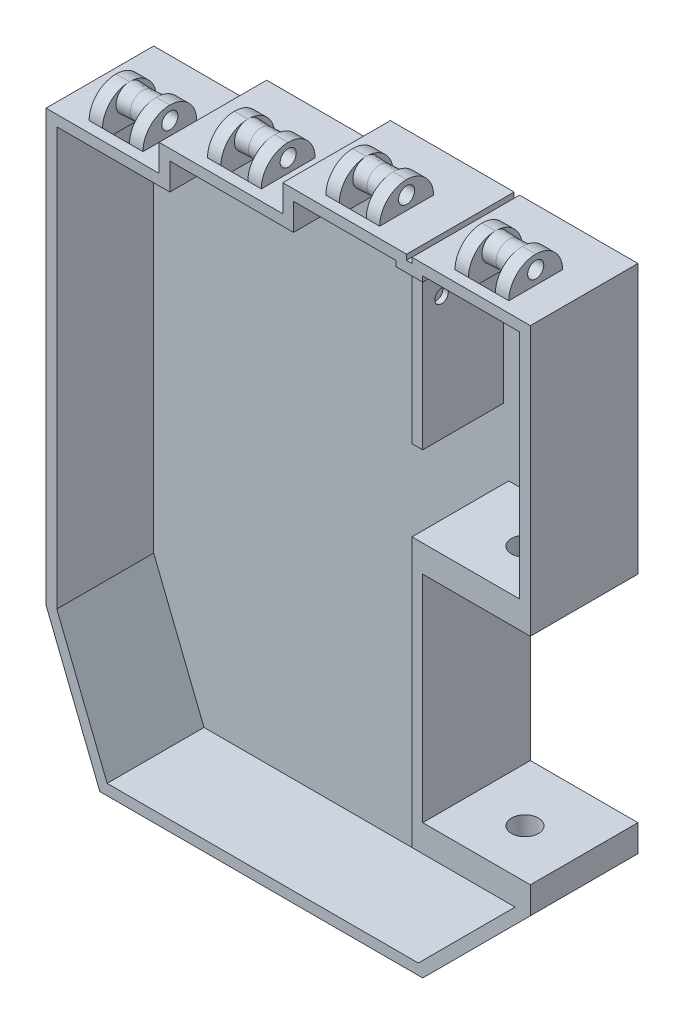
from build123d import *

# Parameters (mm, degrees)
BOSS_EXTRUDE1_DEPTH       = 20
SKETCH2_W                 = 20
SKETCH2_H                 = 40
CUT_EXTRUDE1_DEPTH        = 142.509716981
SHELL1_T                  = -2
SHELL1_THICKNESS_2_FACE_W = 20
SHELL1_THICKNESS_2_FACE_H = 18
SHELL1_THICKNESS_2_DEPTH  = 3
SHELL1_THICKNESS_3_FACE_W = 18
SHELL1_THICKNESS_3_FACE_H = 20
SHELL1_THICKNESS_3_DEPTH  = 3
CUT_EXTRUDE14_REACH       = 110.167
SKETCH34_R                = 2.5
SKETCH3_W                 = 2.5
SKETCH3_H                 = 10
BOSS_EXTRUDE2_DEPTH       = 5
FILLET2_R                 = 5
CUT_EXTRUDE3_REACH        = 149.838
SKETCH6_R                 = 1.5
SKETCH21_R                = 2.5
SKETCH21_R_2              = 1.5
BOSS_EXTRUDE10_DEPTH      = 2.5
BOSS_EXTRUDE10_DRAFT      = 3
MIRROR7_COPY_1_SKETCH_R   = 2.5
MIRROR7_COPY_1_SKETCH_R_2 = 1.5
MIRROR7_COPY_1_DEPTH      = 2.5
MIRROR7_COPY_1_DRAFT      = 3
SKETCH26_W                = 5
SKETCH26_H                = 10
CUT_EXTRUDE8_DEPTH        = 2
SKETCH7_W                 = 2.5
SKETCH7_H                 = 10
BOSS_EXTRUDE4_DEPTH       = 5
FILLET4_R                 = 5
SKETCH22_R                = 2.5
BOSS_EXTRUDE11_DEPTH      = 2.5
BOSS_EXTRUDE11_TAPER      = 3
SKETCH23_R                = 1.5
CUT_EXTRUDE7_DEPTH        = 10
SKETCH27_W                = 5
SKETCH27_H                = 10
CUT_EXTRUDE9_DEPTH        = 2
SKETCH10_W                = 2.5
SKETCH10_H                = 10
BOSS_EXTRUDE6_DEPTH       = 5
FILLET6_R                 = 5
SKETCH28_R                = 2.5
BOSS_EXTRUDE12_DEPTH      = 2.5
BOSS_EXTRUDE12_TAPER      = 3
SKETCH29_R                = 1.5
CUT_EXTRUDE10_DEPTH       = 10
SKETCH30_W                = 5
SKETCH30_H                = 10
CUT_EXTRUDE11_DEPTH       = 2
SKETCH13_W                = 2.5
SKETCH13_H                = 10
BOSS_EXTRUDE8_DEPTH       = 5
FILLET8_R                 = 5
SKETCH31_R                = 2.5
BOSS_EXTRUDE13_DEPTH      = 2.5
BOSS_EXTRUDE13_TAPER      = 3
SKETCH32_R                = 1.5
CUT_EXTRUDE12_DEPTH       = 10
SKETCH33_W                = 5
SKETCH33_H                = 10
CUT_EXTRUDE13_DEPTH       = 2
SKETCH38_W                = 2
SKETCH38_H                = 30
BOSS_EXTRUDE14_DEPTH      = 15
BOSS_EXTRUDE15_DEPTH      = 5
CUT_EXTRUDE15_DEPTH       = 21
CUT_EXTRUDE15_DEPTH_BACK  = 1
SKETCH40_R                = 1.25


with BuildPart() as part:
    # Sketch1 → Boss-Extrude1 (new body)
    with BuildSketch(Plane.XY):
        Polygon((58, 114), (58, 115), (80, 115), (80, 20), (60, 0), (0, 0), (-10, 25), (-10, 105), (11, 105), (11, 110), (12, 110), (34, 110), (34, 115), (35, 115), (57, 115), (57, 114), align=None)
    extrude(amount=BOSS_EXTRUDE1_DEPTH)

    # Sketch2 → Cut-Extrude1 (cut, through all)
    with BuildSketch(Plane.XY.offset(20)):
        with Locations((70, 45)):
            Rectangle(SKETCH2_W, SKETCH2_H)
    extrude(amount=-CUT_EXTRUDE1_DEPTH, mode=Mode.SUBTRACT)

    # Shell1
    shell1_openings = [part.faces().sort_by_distance(p)[0] for p in [
        (32.550473836, 58.500730419, 20),
    ]]
    offset(amount=SHELL1_T, openings=shell1_openings, kind=Kind.INTERSECTION)

    # Shell1 thickness 2 face (on inner face of the shell) → Shell1 thickness 2 (add)
    with BuildSketch(Plane(origin=(68, 23, 11), x_dir=(1, 0, 0), z_dir=(0, 1, 0))):
        Rectangle(SHELL1_THICKNESS_2_FACE_W, SHELL1_THICKNESS_2_FACE_H)
    extrude(amount=-SHELL1_THICKNESS_2_DEPTH)

    # Shell1 thickness 3 face (on inner face of the shell) → Shell1 thickness 3 (add)
    with BuildSketch(Plane(origin=(68, 67, 11), x_dir=(0, 0, -1), z_dir=(0, -1, 0))):
        Rectangle(SHELL1_THICKNESS_3_FACE_W, SHELL1_THICKNESS_3_FACE_H)
    extrude(amount=-SHELL1_THICKNESS_3_DEPTH)

    # Cut-Extrude14: up to this face of the body (flat: up to its plane)
    cut_extrude14_end = Plane(part.part.faces().sort_by_distance((67.585786438, 20, 11))[0])
    # Sketch34 → Cut-Extrude14 (cut, up to the picked face)
    with BuildSketch(Plane(origin=(0, 70, 0), x_dir=(1, 0, 0), z_dir=(0, 1, 0)), mode=Mode.PRIVATE) as cut_extrude14_sk1:
        with Locations(Location((70, -11, 0), (0, 0, 270))):
            Circle(SKETCH34_R)
    cut_extrude14_tool1 = split(extrude(cut_extrude14_sk1.sketch, amount=-CUT_EXTRUDE14_REACH, mode=Mode.PRIVATE), bisect_by=cut_extrude14_end, keep=Keep.BOTH, mode=Mode.PRIVATE)
    add(cut_extrude14_tool1.solids().sort_by(Axis((70, 70, 11), (0, -1, 0)))[0], mode=Mode.SUBTRACT)

    # Sketch3 → Boss-Extrude2 (add)
    with BuildSketch(Plane(origin=(0, 115, 0), x_dir=(1, 0, 0), z_dir=(0, 1, 0))):
        with Locations((65.25, -13)):
            Rectangle(SKETCH3_W, SKETCH3_H)
        with Locations((72.75, -13)):
            Rectangle(SKETCH3_W, SKETCH3_H)
    extrude(amount=BOSS_EXTRUDE2_DEPTH)

    # Fillet2
    fillet2_edges = [part.edges().sort_by_distance(p)[0] for p in [
        (65.25, 120, 8),
        (65.25, 120, 18),
        (72.75, 120, 8),
        (72.75, 120, 18),
    ]]
    fillet(fillet2_edges, radius=FILLET2_R - 0.0001)  # a hair under: the kernel refuses the full size

    # Cut-Extrude3: up to this face of the body (flat: up to its plane)
    cut_extrude3_end = Plane(part.part.faces().sort_by_distance((64, 117.122079053, 13))[0])
    # Sketch6 → Cut-Extrude3 (cut, up to the picked face)
    with BuildSketch(Plane(origin=(74, 0, 0), x_dir=(0, 0, -1), z_dir=(1, 0, 0)), mode=Mode.PRIVATE) as cut_extrude3_sk1:
        with Locations((-13, 117.5)):
            Circle(SKETCH6_R)
    cut_extrude3_tool1 = split(extrude(cut_extrude3_sk1.sketch, amount=-CUT_EXTRUDE3_REACH, mode=Mode.PRIVATE), bisect_by=cut_extrude3_end, keep=Keep.BOTH, mode=Mode.PRIVATE)
    add(cut_extrude3_tool1.solids().sort_by(Axis((74, 117.5, 13), (-1, 0, 0)))[0], mode=Mode.SUBTRACT)


with BuildPart() as boss_extrude10_tool:
    # Sketch21 → Boss-Extrude10 (with draft: the straight prism first)
    with BuildSketch(Plane(origin=(66.5, 0, 0), x_dir=(0, 0, -1), z_dir=(1, 0, 0))):
        with Locations((-13, 117.5)):
            Circle(SKETCH21_R)
        with Locations((-13, 117.5)):
            Circle(SKETCH21_R_2, mode=Mode.SUBTRACT)
    extrude(amount=BOSS_EXTRUDE10_DEPTH)
    # Boss-Extrude10: the draft: its side faces are tilted about the plane it starts from
    boss_extrude10_sides = [boss_extrude10_tool.faces().sort_by_distance(p)[0] for p in [
        (67.75, 117.5, 15.5),
        (67.75, 117.5, 14.5),
    ]]
    draft(boss_extrude10_sides, Plane(origin=(66.5, 0, 0), x_dir=(0, 0, -1), z_dir=(1, 0, 0)), BOSS_EXTRUDE10_DRAFT)


with BuildPart() as part_1:
    add(part.part)

    # Boss-Extrude10: add boss_extrude10_tool
    add(boss_extrude10_tool.part)


with BuildPart() as mirror7_copy_1_tool:
    # Mirror7 copy 1 sketch → Mirror7 copy 1 (with draft: the straight prism first)
    with BuildSketch(Plane(origin=(71.5, 0, 0), x_dir=(0, 0, -1), z_dir=(-1, 0, 0))):
        with Locations((-13, -117.5)):
            Circle(MIRROR7_COPY_1_SKETCH_R)
        with Locations((-13, -117.5)):
            Circle(MIRROR7_COPY_1_SKETCH_R_2, mode=Mode.SUBTRACT)
    extrude(amount=MIRROR7_COPY_1_DEPTH)
    # Mirror7 copy 1: the draft: its side faces are tilted about the plane it starts from
    mirror7_copy_1_sides = [mirror7_copy_1_tool.faces().sort_by_distance(p)[0] for p in [
        (70.25, 117.5, 15.5),
        (70.25, 117.5, 14.5),
    ]]
    draft(mirror7_copy_1_sides, Plane(origin=(71.5, 0, 0), x_dir=(0, 0, -1), z_dir=(-1, 0, 0)), MIRROR7_COPY_1_DRAFT)


with BuildPart() as part_2:
    add(part_1.part)

    # Mirror7 copy 1: add mirror7_copy_1_tool
    add(mirror7_copy_1_tool.part)

    # Sketch26 → Cut-Extrude8 (cut)
    with BuildSketch(Plane(origin=(0, 115, 0), x_dir=(1, 0, 0), z_dir=(0, 1, 0))):
        with Locations((69, -13)):
            Rectangle(SKETCH26_W, SKETCH26_H)
    extrude(amount=-CUT_EXTRUDE8_DEPTH, mode=Mode.SUBTRACT)

    # Sketch7 → Boss-Extrude4 (add)
    with BuildSketch(Plane(origin=(0, 115, 0), x_dir=(1, 0, 0), z_dir=(0, 1, 0))):
        with Locations((41.25, -13)):
            Rectangle(SKETCH7_W, SKETCH7_H)
        with Locations((48.75, -13)):
            Rectangle(SKETCH7_W, SKETCH7_H)
    extrude(amount=BOSS_EXTRUDE4_DEPTH)

    # Fillet4
    fillet4_edges = [part_2.edges().sort_by_distance(p)[0] for p in [
        (41.25, 120, 8),
        (41.25, 120, 18),
        (48.75, 120, 8),
        (48.75, 120, 18),
    ]]
    fillet(fillet4_edges, radius=FILLET4_R - 0.0001)  # a hair under: the kernel refuses the full size

    # Sketch22 → Boss-Extrude11 (add)
    with BuildSketch(Plane(origin=(42.5, 0, 0), x_dir=(0, 0, -1), z_dir=(1, 0, 0))):
        with Locations((-13, 117.5)):
            Circle(SKETCH22_R)
    boss_extrude11 = extrude(amount=BOSS_EXTRUDE11_DEPTH, taper=BOSS_EXTRUDE11_TAPER)

    # Mirror8: Boss-Extrude11 across plane
    add(boss_extrude11.mirror(Plane(origin=(45, 117.5, 13), x_dir=(0, 0, 1), z_dir=(1, 0, 0))))

    # Sketch23 → Cut-Extrude7 (cut)
    with BuildSketch(Plane(origin=(50, 0, 0), x_dir=(0, 0, -1), z_dir=(1, 0, 0))):
        with Locations((-13, 117.5)):
            Circle(SKETCH23_R)
    extrude(amount=-CUT_EXTRUDE7_DEPTH, mode=Mode.SUBTRACT)

    # Sketch27 → Cut-Extrude9 (cut)
    with BuildSketch(Plane(origin=(0, 115, 0), x_dir=(1, 0, 0), z_dir=(0, 1, 0))):
        with Locations((45, -13)):
            Rectangle(SKETCH27_W, SKETCH27_H)
    extrude(amount=-CUT_EXTRUDE9_DEPTH, mode=Mode.SUBTRACT)

    # Sketch10 → Boss-Extrude6 (add)
    with BuildSketch(Plane(origin=(0, 110, 0), x_dir=(1, 0, 0), z_dir=(0, 1, 0))):
        with Locations((19.25, -13)):
            Rectangle(SKETCH10_W, SKETCH10_H)
        with Locations((26.75, -13)):
            Rectangle(SKETCH10_W, SKETCH10_H)
    extrude(amount=BOSS_EXTRUDE6_DEPTH)

    # Fillet6
    fillet6_edges = [part_2.edges().sort_by_distance(p)[0] for p in [
        (19.25, 115, 18),
        (19.25, 115, 8),
        (26.75, 115, 8),
        (26.75, 115, 18),
    ]]
    fillet(fillet6_edges, radius=FILLET6_R - 0.0001)  # a hair under: the kernel refuses the full size

    # Sketch28 → Boss-Extrude12 (add)
    with BuildSketch(Plane(origin=(20.5, 0, 0), x_dir=(0, 0, -1), z_dir=(1, 0, 0))):
        with Locations((-13, 112.5)):
            Circle(SKETCH28_R)
    boss_extrude12 = extrude(amount=BOSS_EXTRUDE12_DEPTH, taper=BOSS_EXTRUDE12_TAPER)

    # Mirror9: Boss-Extrude12 across plane
    add(boss_extrude12.mirror(Plane(origin=(23, 112.5, 13), x_dir=(0, 0, 1), z_dir=(1, 0, 0))))

    # Sketch29 → Cut-Extrude10 (cut)
    with BuildSketch(Plane(origin=(28, 0, 0), x_dir=(0, 0, -1), z_dir=(1, 0, 0))):
        with Locations((-13, 112.5)):
            Circle(SKETCH29_R)
    extrude(amount=-CUT_EXTRUDE10_DEPTH, mode=Mode.SUBTRACT)

    # Sketch30 → Cut-Extrude11 (cut)
    with BuildSketch(Plane(origin=(0, 110, 0), x_dir=(1, 0, 0), z_dir=(0, 1, 0))):
        with Locations((23, -13)):
            Rectangle(SKETCH30_W, SKETCH30_H)
    extrude(amount=-CUT_EXTRUDE11_DEPTH, mode=Mode.SUBTRACT)

    # Sketch13 → Boss-Extrude8 (add)
    with BuildSketch(Plane(origin=(0, 105, 0), x_dir=(1, 0, 0), z_dir=(0, 1, 0))):
        with Locations((-2.75, -13)):
            Rectangle(SKETCH13_W, SKETCH13_H)
        with Locations((4.75, -13)):
            Rectangle(SKETCH13_W, SKETCH13_H)
    extrude(amount=BOSS_EXTRUDE8_DEPTH)

    # Fillet8
    fillet8_edges = [part_2.edges().sort_by_distance(p)[0] for p in [
        (-2.75, 110, 18),
        (-2.75, 110, 8),
        (4.75, 110, 8),
        (4.75, 110, 18),
    ]]
    fillet(fillet8_edges, radius=FILLET8_R - 0.0001)  # a hair under: the kernel refuses the full size

    # Sketch31 → Boss-Extrude13 (add)
    with BuildSketch(Plane(origin=(-1.5, 0, 0), x_dir=(0, 0, -1), z_dir=(1, 0, 0))):
        with Locations((-13, 107.5)):
            Circle(SKETCH31_R)
    boss_extrude13 = extrude(amount=BOSS_EXTRUDE13_DEPTH, taper=BOSS_EXTRUDE13_TAPER)

    # Mirror10: Boss-Extrude13 across plane
    add(boss_extrude13.mirror(Plane(origin=(1, 107.5, 13), x_dir=(0, 0, 1), z_dir=(1, 0, 0))))

    # Sketch32 → Cut-Extrude12 (cut)
    with BuildSketch(Plane(origin=(6, 0, 0), x_dir=(0, 0, -1), z_dir=(1, 0, 0))):
        with Locations((-13, 107.5)):
            Circle(SKETCH32_R)
    extrude(amount=-CUT_EXTRUDE12_DEPTH, mode=Mode.SUBTRACT)

    # Sketch33 → Cut-Extrude13 (cut)
    with BuildSketch(Plane(origin=(0, 105, 0), x_dir=(1, 0, 0), z_dir=(0, 1, 0))):
        with Locations((1, -13)):
            Rectangle(SKETCH33_W, SKETCH33_H)
    extrude(amount=-CUT_EXTRUDE13_DEPTH, mode=Mode.SUBTRACT)

    # Sketch38 → Boss-Extrude14 (add)
    with BuildSketch(Plane.XY.offset(2)):
        with Locations((56, 97)):
            Rectangle(SKETCH38_W, SKETCH38_H)
    extrude(amount=BOSS_EXTRUDE14_DEPTH)

    # Sketch39 → Boss-Extrude15 (add)
    with BuildSketch(Plane.XY.offset(2)):
        Polygon((66, 98.2), (66, 100.2), (71, 100.2), (71, 90.2), (69, 90.2), (69, 98.2), align=None)
    extrude(amount=BOSS_EXTRUDE15_DEPTH)

    # Sketch40 → Cut-Extrude15 (cut, two sides: drawn at the far end of the back side and taken through both)
    with BuildSketch(Plane(origin=(57, 0, 0), x_dir=(0, 0, -1), z_dir=(1, 0, 0)).offset(-CUT_EXTRUDE15_DEPTH_BACK)):
        with Locations(Location((-13.5, 105, 0), (0, 0, 180))):
            Circle(SKETCH40_R)
    extrude(amount=CUT_EXTRUDE15_DEPTH + CUT_EXTRUDE15_DEPTH_BACK, mode=Mode.SUBTRACT)


solid = part_2.part
